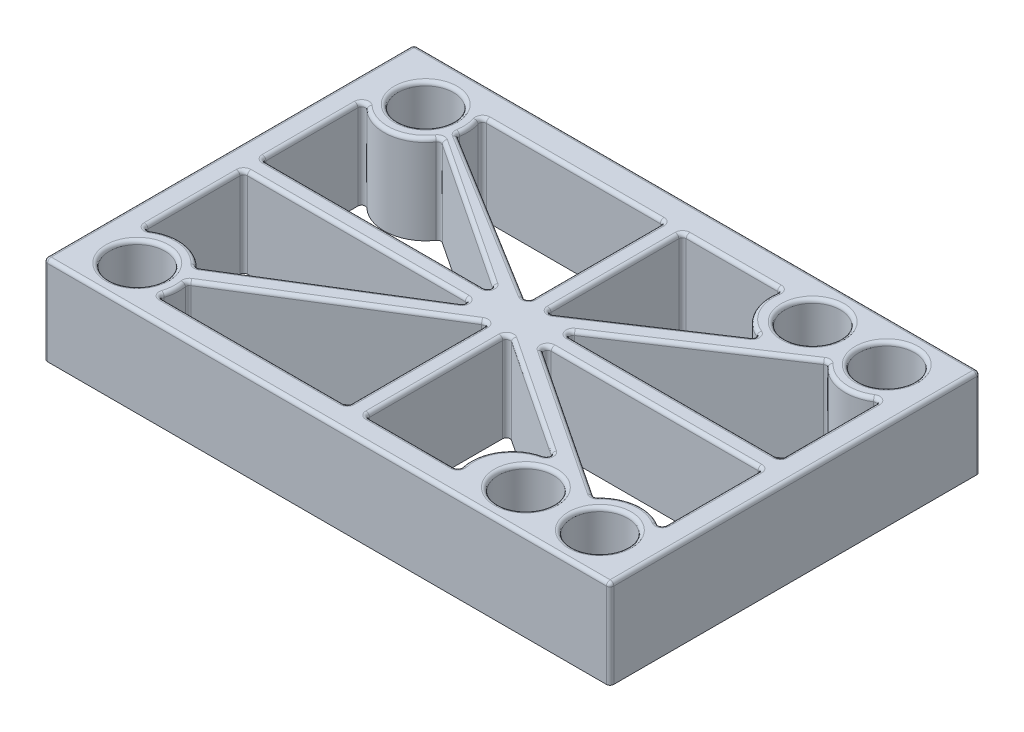
from build123d import *

# Parameters (mm, degrees)
BOSS_EXTRUDE1_OUTLINE_R = 3.81
BOSS_EXTRUDE1_DEPTH     = 12.192
FILLET1_R               = 0.508


# Read off the part's stored shape, not the designer's step: Boss-Extrude1
with BuildPart() as part:
    # Boss-Extrude1 outline → Boss-Extrude1 (new body)
    with BuildSketch(Plane(origin=(0, 0, 0), x_dir=(1, 0, 0), z_dir=(0, 1, 0))):
        with BuildLine():
            ThreePointArc((-1.016, 50.8), (-1.375210245, 50.651210245), (-1.524, 50.292))
            Line((-1.524, 50.292), (-1.524, 0.508))
            ThreePointArc((-1.524, 0.508), (-1.375210245, 0.148789755), (-1.016, 0))
            Line((-1.016, 0), (75.692, 0))
            ThreePointArc((75.692, 0), (76.051210245, 0.148789755), (76.2, 0.508))
            Line((76.2, 0.508), (76.2, 50.292))
            ThreePointArc((76.2, 50.292), (76.051210245, 50.651210245), (75.692, 50.8))
            Line((75.692, 50.8), (-1.016, 50.8))
        make_face()
        with Locations((5.588, 5.715)):
            Circle(BOSS_EXTRUDE1_OUTLINE_R, mode=Mode.SUBTRACT)
        with BuildLine():
            Line((2.286, 24.13), (32.20487074, 24.13))
            ThreePointArc((32.20487074, 24.13), (32.693548193, 23.760774447), (32.471862643, 23.189820264))
            Line((32.471862643, 23.189820264), (10.387690405, 9.546665159))
            ThreePointArc((10.387690405, 9.546665159), (10.054199203, 9.475216219), (9.750682298, 9.630775924))
            ThreePointArc((9.750682298, 9.630775924), (6.319308104, 11.383016713), (2.55555102, 10.559117896))
            ThreePointArc((2.55555102, 10.559117896), (2.039898312, 10.545298728), (1.778, 10.989706153))
            Line((1.778, 10.989706153), (1.778, 23.622))
            ThreePointArc((1.778, 23.622), (1.926789755, 23.981210245), (2.286, 24.13))
        make_face(mode=Mode.SUBTRACT)
        with BuildLine():
            Line((11.45199968, 7.203984983), (36.053547005, 22.51759977))
            ThreePointArc((36.053547005, 22.51759977), (36.56866767, 22.530419614), (36.83, 22.086326087))
            Line((36.83, 22.086326087), (36.83, 3.81))
            ThreePointArc((36.83, 3.81), (36.681210245, 3.450789755), (36.322, 3.302))
            Line((36.322, 3.302), (11.512247125, 3.302))
            ThreePointArc((11.512247125, 3.302), (11.101721131, 3.510780335), (11.028635115, 3.965510204))
            ThreePointArc((11.028635115, 3.965510204), (11.288939939, 5.314364497), (11.219844293, 6.686367521))
            ThreePointArc((11.219844293, 6.686367521), (11.256938047, 6.980601152), (11.45199968, 7.203984983))
        make_face(mode=Mode.SUBTRACT)
        with Locations((58.928, 5.715)):
            Circle(BOSS_EXTRUDE1_OUTLINE_R, mode=Mode.SUBTRACT)
        with Locations((69.088, 5.715)):
            Circle(BOSS_EXTRUDE1_OUTLINE_R, mode=Mode.SUBTRACT)
        with BuildLine():
            Line((39.37, 3.81), (39.37, 22.086326087))
            ThreePointArc((39.37, 22.086326087), (39.637815836, 22.533959383), (40.158880186, 22.509611241))
            Line((40.158880186, 22.509611241), (56.435320497, 11.709020801))
            ThreePointArc((56.435320497, 11.709020801), (56.654180853, 11.194503031), (56.267636808, 10.790507868))
            ThreePointArc((56.267636808, 10.790507868), (52.695472585, 8.24923581), (51.97455651, 3.925036356))
            ThreePointArc((51.97455651, 3.925036356), (51.877560912, 3.494068416), (51.479752875, 3.302))
            Line((51.479752875, 3.302), (39.878, 3.302))
            ThreePointArc((39.878, 3.302), (39.518789755, 3.450789755), (39.37, 3.81))
        make_face(mode=Mode.SUBTRACT)
        with BuildLine():
            ThreePointArc((43.714249074, 23.198714847), (43.50876887, 23.768688688), (43.99512926, 24.13))
            Line((43.99512926, 24.13), (72.39, 24.13))
            ThreePointArc((72.39, 24.13), (72.749210245, 23.981210245), (72.898, 23.622))
            Line((72.898, 23.622), (72.898, 10.989706153))
            ThreePointArc((72.898, 10.989706153), (72.636101688, 10.545298728), (72.12044898, 10.559117896))
            ThreePointArc((72.12044898, 10.559117896), (68.356691896, 11.383016713), (64.925317702, 9.630775924))
            ThreePointArc((64.925317702, 9.630775924), (64.613616813, 9.474203117), (64.274421312, 9.555559741))
            Line((64.274421312, 9.555559741), (43.714249074, 23.198714847))
        make_face(mode=Mode.SUBTRACT)
        with BuildLine():
            Line((32.20487074, 26.67), (2.286, 26.67))
            ThreePointArc((2.286, 26.67), (1.926789755, 26.818789755), (1.778, 27.178))
            Line((1.778, 27.178), (1.778, 39.810293847))
            ThreePointArc((1.778, 39.810293847), (2.083337394, 40.276117706), (2.632298693, 40.18196738))
            ThreePointArc((2.632298693, 40.18196738), (7.141883656, 38.68134364), (11.227021807, 41.110309352))
            ThreePointArc((11.227021807, 41.110309352), (11.54890656, 41.320041769), (11.925578688, 41.244440259))
            Line((11.925578688, 41.244440259), (32.485750926, 27.601285153))
            ThreePointArc((32.485750926, 27.601285153), (32.69123113, 27.031311312), (32.20487074, 26.67))
        make_face(mode=Mode.SUBTRACT)
        with BuildLine():
            Line((36.83, 46.268294629), (36.83, 28.713673913))
            ThreePointArc((36.83, 28.713673913), (36.569592689, 28.270095442), (36.055347007, 28.281284989))
            Line((36.055347007, 28.281284989), (12.39395867, 42.873194404))
            ThreePointArc((12.39395867, 42.873194404), (12.197531315, 43.096727896), (12.160003281, 43.391927108))
            ThreePointArc((12.160003281, 43.391927108), (12.229098928, 44.763930132), (11.968794103, 46.112784425))
            ThreePointArc((11.968794103, 46.112784425), (12.04188012, 46.567514294), (12.452406114, 46.776294629))
            Line((12.452406114, 46.776294629), (36.322, 46.776294629))
            ThreePointArc((36.322, 46.776294629), (36.681210245, 46.627504874), (36.83, 46.268294629))
        make_face(mode=Mode.SUBTRACT)
        with Locations((6.528158988, 44.363294629)):
            Circle(BOSS_EXTRUDE1_OUTLINE_R, mode=Mode.SUBTRACT)
        with BuildLine():
            ThreePointArc((56.350783132, 39.982787027), (56.660173195, 39.562204418), (56.435320497, 39.090979199))
            Line((56.435320497, 39.090979199), (40.158880186, 28.290388759))
            ThreePointArc((40.158880186, 28.290388759), (39.637815836, 28.266040617), (39.37, 28.713673913))
            Line((39.37, 28.713673913), (39.37, 46.268294629))
            ThreePointArc((39.37, 46.268294629), (39.518789756, 46.627504874), (39.878, 46.776294629))
            Line((39.878, 46.776294629), (52.419911863, 46.776294629))
            ThreePointArc((52.419911863, 46.776294629), (52.807300545, 46.596919048), (52.92111415, 46.185467893))
            ThreePointArc((52.92111415, 46.185467893), (53.558273523, 42.488244969), (56.350783132, 39.982787027))
        make_face(mode=Mode.SUBTRACT)
        with BuildLine():
            Line((72.39, 26.67), (43.99512926, 26.67))
            ThreePointArc((43.99512926, 26.67), (43.50876887, 27.031311312), (43.714249074, 27.601285153))
            Line((43.714249074, 27.601285153), (64.274421312, 41.244440259))
            ThreePointArc((64.274421312, 41.244440259), (64.613616813, 41.325796883), (64.925317702, 41.169224076))
            ThreePointArc((64.925317702, 41.169224076), (68.356691896, 39.416983287), (72.12044898, 40.240882104))
            ThreePointArc((72.12044898, 40.240882104), (72.636101688, 40.254701272), (72.898, 39.810293847))
            Line((72.898, 39.810293847), (72.898, 27.178))
            ThreePointArc((72.898, 27.178), (72.749210245, 26.818789755), (72.39, 26.67))
        make_face(mode=Mode.SUBTRACT)
        with Locations((58.928, 45.085)):
            Circle(BOSS_EXTRUDE1_OUTLINE_R, mode=Mode.SUBTRACT)
        with Locations((69.088, 45.085)):
            Circle(BOSS_EXTRUDE1_OUTLINE_R, mode=Mode.SUBTRACT)
    extrude(amount=BOSS_EXTRUDE1_DEPTH)

    # Fillet1
    fillet1_edges = [part.edges().sort_by_distance(p)[0] for p in [
        (12.04188012, 12.192, -46.567514294),
        (24.387203057, 12.192, -46.776294629),
        (36.681210245, 12.192, -46.627504874),
        (36.83, 12.192, -37.490984271),
        (39.637815836, 12.192, -22.533959383),
        (48.297100341, 12.192, -17.109316021),
        (56.654180853, 12.192, -11.194503031),
        (52.695472585, 12.192, -8.24923581),
        (51.877560912, 12.192, -3.494068416),
        (45.678876438, 12.192, -3.302),
        (39.518789755, 12.192, -3.450789755),
        (39.37, 12.192, -12.948163044),
        (65.278, 12.192, -5.715),
        (65.278, 12.192, -45.085),
        (1.778, 12.192, -5.715),
        (2.718158988, 12.192, -44.363294629),
        (55.118, 12.192, -5.715),
        (55.118, 12.192, -45.085),
        (23.752773342, 12.192, -14.860792377),
        (36.56866767, 12.192, -22.530419614),
        (36.83, 12.192, -12.948163043),
        (36.681210245, 12.192, -3.450789755),
        (-1.375210245, 12.192, -50.651210245),
        (23.917123563, 12.192, -3.302),
        (11.101721131, 12.192, -3.510780335),
        (11.288939939, 12.192, -5.314364497),
        (11.256938047, 12.192, -6.980601152),
        (58.19256463, 12.192, -26.67),
        (43.50876887, 12.192, -27.031311312),
        (53.994335193, 12.192, -34.422862706),
        (64.613616813, 12.192, -41.325796883),
        (68.356691896, 12.192, -39.416983287),
        (72.636101688, 12.192, -40.254701272),
        (-1.524, 12.192, -25.4),
        (72.898, 12.192, -33.494146923),
        (72.749210245, 12.192, -26.818789755),
        (48.297100341, 12.192, -33.690683979),
        (39.637815836, 12.192, -28.266040617),
        (39.37, 12.192, -37.490984271),
        (39.518789756, 12.192, -46.627504874),
        (46.148955931, 12.192, -46.776294629),
        (52.807300545, 12.192, -46.596919048),
        (53.558273523, 12.192, -42.488244969),
        (56.660173195, 12.192, -39.562204418),
        (17.24543537, 12.192, -24.13),
        (32.693548193, 12.192, -23.760774447),
        (21.429776524, 12.192, -16.368242712),
        (-1.375210245, 12.192, -0.148789755),
        (10.054199203, 12.192, -9.475216219),
        (6.319308104, 12.192, -11.383016713),
        (2.039898312, 12.192, -10.545298728),
        (1.778, 12.192, -17.305853077),
        (1.926789755, 12.192, -23.981210245),
        (58.19256463, 12.192, -24.13),
        (72.749210245, 12.192, -23.981210245),
        (72.898, 12.192, -17.305853077),
        (72.636101688, 12.192, -10.545298728),
        (68.356691896, 12.192, -11.383016713),
        (37.338, 12.192, 0),
        (64.613616813, 12.192, -9.474203117),
        (53.994335193, 12.192, -16.377137294),
        (43.50876887, 12.192, -23.768688688),
        (76.051210245, 12.192, -0.148789755),
        (76.2, 12.192, -25.4),
        (76.051210245, 12.192, -50.651210245),
        (37.338, 12.192, -50.8),
        (1.926789755, 12.192, -26.818789755),
        (1.778, 12.192, -33.494146923),
        (2.083337394, 12.192, -40.276117706),
        (7.141883656, 12.192, -38.68134364),
        (11.54890656, 12.192, -41.320041769),
        (22.205664807, 12.192, -34.422862706),
        (32.69123113, 12.192, -27.031311312),
        (17.24543537, 12.192, -26.67),
        (36.569592689, 12.192, -28.270095442),
        (24.224652838, 12.192, -35.577239697),
        (12.197531315, 12.192, -43.096727896),
        (12.229098928, 12.192, -44.763930132),
    ]]
    fillet(fillet1_edges, radius=FILLET1_R)


solid = part.part
